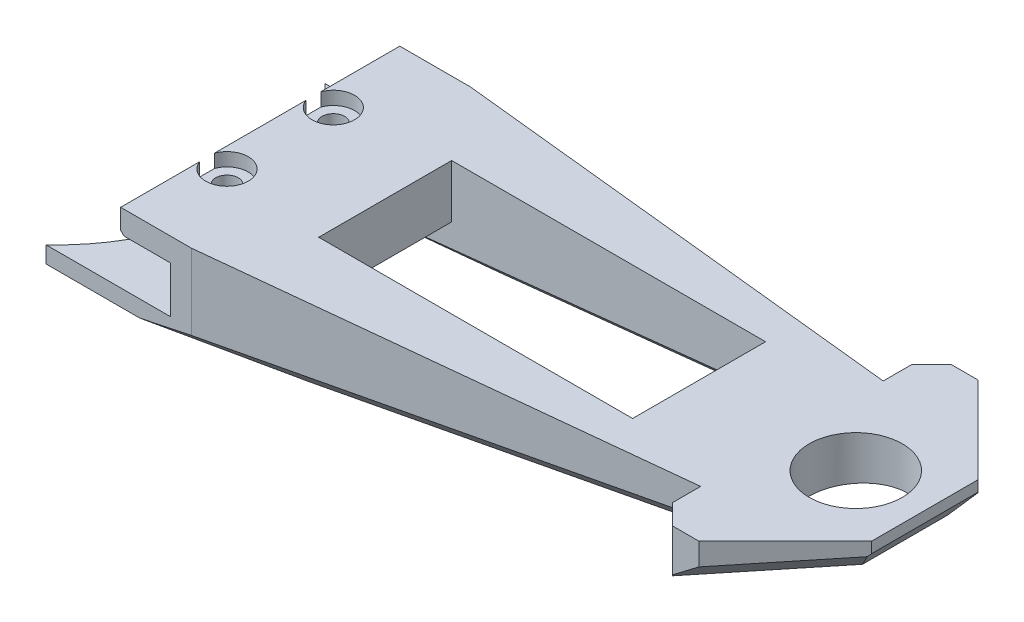
from build123d import *
from OCP.BRepFilletAPI import BRepFilletAPI_MakeChamfer

# Parameters (mm, degrees)
SKETCH_1_W          = 100
SKETCH_1_H          = 42
SKETCH_1_R          = 1.7
EXTRUDE_1_DEPTH     = 4
SKETCH_4_W          = 93
SKETCH_4_H          = 42
EXTRUDE_3_DEPTH     = 6
EXTRUDE_START       = 3
SKETCH_5_R          = 1.7
EXTRUDE_4_DEPTH     = 3
CHAMFER_1_SIZE      = 8
CHAMFER_1_SIZE2     = 76.114915634
CHAMFER_2_SIZE      = 1
SKETCH_13_W         = 47.230725809
SKETCH_13_H         = 10
SKETCH_13_R         = 7
CUT_EXTRUDE_4_DEPTH = 44
CHAMFER_6_SIZE      = 13
CHAMFER_7_SIZE      = 3
SKETCH_11_W         = 2.004930736
SKETCH_11_H         = 0.807415545
SKETCH_11_W_2       = 2.004930737
SKETCH_11_W_3       = 0.619925793
SKETCH_11_H_2       = 2.038195048
SKETCH_11_W_4       = 0.405219787
EXTRUDE_6_DEPTH     = 1
CHAMFER_8_SIZE      = 3
CHAMFER_8_SIZE2     = 3.249032056
CHAMFER_8_SIZE2_2   = 3.370811392
CHAMFER_9_SIZE      = 3
CHAMFER_9_SIZE2     = 3.033196678
CHAMFER_10_SIZE     = 5
CHAMFER_11_SIZE     = 3
CHAMFER_11_SIZE2    = 2.729629244
CHAMFER_12_SIZE     = 2
SKETCH_14_R         = 3.2
CUT_EXTRUDE_8_DEPTH = 2
CUT_EXTRUDE_9_DEPTH = 110


with BuildPart() as part:
    # 草图1 → 凸台-拉伸1 (new body)
    with BuildSketch(Plane(origin=(0, 0, 0), x_dir=(1, 0, 0), z_dir=(0, 1, 0))):
        with Locations((50, -21)):
            Rectangle(SKETCH_1_W, SKETCH_1_H)
        with Locations(Location((3, -29, 0), (0, 0, 270))):
            Circle(SKETCH_1_R, mode=Mode.SUBTRACT)
        with Locations(Location((3, -13, 0), (0, 0, 90))):
            Circle(SKETCH_1_R, mode=Mode.SUBTRACT)
    extrude(amount=EXTRUDE_1_DEPTH)

    # 草图4 → 凸台-拉伸3 (add)
    with BuildSketch(Plane.XZ):
        with Locations((53.5, 21)):
            Rectangle(SKETCH_4_W, SKETCH_4_H)
    extrude(amount=EXTRUDE_3_DEPTH)

    # 草图5 → 凸台-拉伸4 (add)
    with BuildSketch(Plane.XZ.offset(6).offset(EXTRUDE_START)):
        with BuildLine():
            Line((0, 42), (100, 42))
            Line((100, 42), (100, 0))
            Line((100, 0), (0, 0))
            Line((0, 0), (-11.232151132, 0))
            ThreePointArc((-11.232151132, 0), (-2, 21), (-11.232151132, 42))
            Line((-11.232151132, 42), (0, 42))
        make_face()
        with Locations(Location((3, 29, 0), (0, 0, 90))):
            Circle(SKETCH_5_R, mode=Mode.SUBTRACT)
        with Locations(Location((3, 13, 0), (0, 0, 270))):
            Circle(SKETCH_5_R, mode=Mode.SUBTRACT)
    extrude(amount=-EXTRUDE_4_DEPTH)

    # 倒角1
    chamfer_1_edges = [part.edges().sort_by_distance(p)[0] for p in [
        (100, -9, 21),
    ]]
    chamfer_1_side = [part.faces().sort_by_distance(p)[0] for p in [
        (100, -2.5, 21),
    ]]
    chamfer(chamfer_1_edges, length=CHAMFER_1_SIZE, length2=CHAMFER_1_SIZE2, reference=chamfer_1_side[0])

    # 倒角2
    chamfer_2_edges = [part.edges().sort_by_distance(p)[0] for p in [
        (0, 0, 21),
    ]]
    chamfer(chamfer_2_edges, length=CHAMFER_2_SIZE)

    # 草图13 → 切除-拉伸4 (cut)
    with BuildSketch(Plane(origin=(0, 4, 0), x_dir=(1, 0, 0), z_dir=(0, 1, 0))):
        Polygon((10.629734183, -42), (80, -42), (80, -34.736546255), align=None)
        with Locations((42.419369789, -26)):
            Rectangle(SKETCH_13_W, SKETCH_13_H)
        Polygon((80, -7.263453745), (80, 0), (10.629734183, 0), align=None)
        with Locations((42.419369789, -16)):
            Rectangle(SKETCH_13_W, SKETCH_13_H)
        with Locations(Location((89.611584168, -21, 0), (0, 0, 270))):
            Circle(SKETCH_13_R)
    extrude(amount=-CUT_EXTRUDE_4_DEPTH, mode=Mode.SUBTRACT)

    # 倒角6
    chamfer_6_edges = [part.edges().sort_by_distance(p)[0] for p in [
        (100, 1.5, 0),
        (100, 1.5, 42),
    ]]
    chamfer(chamfer_6_edges, length=CHAMFER_6_SIZE)

    # 倒角7
    chamfer_7_edges = [part.edges().sort_by_distance(p)[0] for p in [
        (80, 0.448957647, 42),
        (80, 0.448957647, 0),
    ]]
    chamfer(chamfer_7_edges, length=CHAMFER_7_SIZE)

    # 草图11 → 凸台-拉伸6 (add)
    # profile 1 of 3: a face of its own
    with BuildSketch(Plane(origin=(1.196575809, -11.384658341, 0), x_dir=(0.9945218953682733, 0.10452846326765426, 0), z_dir=(0.10452846326765428, -0.9945218953682734, 0))):
        Polygon((69.860880518, 16.187261812), (69.860880518, 17.411993258), (70.105826807, 17.411993258), (70.105826807, 18.22545686), (69.65675861, 18.671501028), (70.553382989, 19.852384064), (71.121900302, 19.444140249), (77.544936327, 19.444140249), (77.544936327, 18.219408803), (76.810097459, 18.219408803), (76.810097459, 17.411993258), (77.62658509, 17.411993258), (77.62658509, 16.187261812), align=None)
        with Locations((74.909495698, 17.815701031)):
            Rectangle(SKETCH_11_W, SKETCH_11_H, mode=Mode.SUBTRACT)
        with Locations((72.006428569, 17.815701031)):
            Rectangle(SKETCH_11_W_2, SKETCH_11_H, mode=Mode.SUBTRACT)
    # profile 2 of 3: a face of its own
    with BuildSketch(Plane(origin=(1.196575809, -11.384658341, 0), x_dir=(0.9945218953682733, 0.10452846326765426, 0), z_dir=(0.10452846326765428, -0.9945218953682734, 0))):
        with BuildLine():
            Line((73.743732804, 20.141178762), (73.743732804, 21.489895366))
            Line((73.743732804, 21.489895366), (73.988679093, 21.489895366))
            Line((73.988679093, 21.489895366), (73.988679093, 23.570426809))
            Line((73.988679093, 23.570426809), (73.580435278, 23.937846243))
            Line((73.580435278, 23.937846243), (74.396922908, 25.244226451))
            Line((74.396922908, 25.244226451), (74.8883275, 24.876807018))
            Line((74.8883275, 24.876807018), (77.873043393, 24.876807018))
            add(Edge.make_bspline(
                [(77.873043393, 24.876807018), (77.909195425, 24.884114021), (77.979030125, 24.898228922), (78.083535505, 24.898260892), (78.18247526, 24.888096269), (78.274375586, 24.857634965), (78.361174864, 24.815510666), (78.440062892, 24.754438601), (78.514651653, 24.680459701), (78.581581254, 24.589308152), (78.641153636, 24.483219793), (78.695783555, 24.362834367), (78.74420221, 24.227285764), (78.78536843, 24.075844921), (78.823948154, 23.909673827), (78.853080426, 23.727704353), (78.87757312, 23.53102708), (78.888168983, 23.394584904), (78.893652931, 23.323968506)],
                knots=[0, 0, 0, 0, 0.827263588, 1.598020928, 2.340253185, 3.053540043, 3.76312571, 4.499799397, 5.285166813, 6.119311175, 7.033042428, 8.016965305, 9.088859635, 10.265792637, 11.544263093, 12.923035739, 14.407500252, 16, 16, 16, 16], degree=3))
            add(Edge.make_bspline(
                [(78.893652931, 23.323968506), (78.845246059, 23.328323663), (78.753264032, 23.336599269), (78.620846423, 23.311971446), (78.505741453, 23.257011785), (78.407474701, 23.17222843), (78.32882796, 23.056565697), (78.267259898, 22.912798583), (78.222626533, 22.740439523), (78.20762963, 22.615095523), (78.199638445, 22.548305257)],
                knots=[0, 0, 0, 0, 0.974397038, 1.851534954, 2.672531398, 3.514004096, 4.431205496, 5.461919598, 6.647569389, 8, 8, 8, 8], degree=3))
            Line((78.199638445, 22.548305257), (77.668921485, 22.466656494))
            add(Edge.make_bspline(
                [(77.668921485, 22.466656494), (77.676599849, 22.514514334), (77.691289688, 22.606073427), (77.710604215, 22.73849245), (77.721281907, 22.861229398), (77.732590351, 22.973497898), (77.732180701, 23.075975967), (77.733151762, 23.168024765), (77.722536119, 23.249609583), (77.711807698, 23.321856538), (77.693885438, 23.383253279), (77.671409021, 23.435462621), (77.641955792, 23.475795943), (77.610544471, 23.510743362), (77.569530677, 23.529227283), (77.525069221, 23.54104806), (77.475191645, 23.540431553), (77.441487802, 23.532310259), (77.423975196, 23.528090414)],
                knots=[0, 0, 0, 0, 1.834201696, 3.509097869, 5.061374665, 6.496278519, 7.774185948, 8.937680646, 9.973858727, 10.883093303, 11.697811954, 12.389123654, 13.018759541, 13.585142942, 14.139519144, 14.689944872, 15.319291869, 16, 16, 16, 16], degree=3))
            Line((77.423975196, 23.528090414), (77.26067767, 23.528090414))
            Line((77.26067767, 23.528090414), (77.26067767, 21.489895366))
            Line((77.26067767, 21.489895366), (78.812004168, 21.489895366))
            Line((78.812004168, 21.489895366), (78.812004168, 20.141178762))
            Line((78.812004168, 20.141178762), (73.743732804, 20.141178762))
        make_face()
        with Locations((76.215875907, 22.50899289)):
            Rectangle(SKETCH_11_W_3, SKETCH_11_H_2, mode=Mode.SUBTRACT)
        with Locations((74.96846425, 22.50899289)):
            Rectangle(SKETCH_11_W_4, SKETCH_11_H_2, mode=Mode.SUBTRACT)
    # profile 3 of 3: a face of its own
    with BuildSketch(Plane(origin=(1.196575809, -11.384658341, 0), x_dir=(0.9945218953682733, 0.10452846326765426, 0), z_dir=(0.10452846326765428, -0.9945218953682734, 0))):
        Polygon((70.021154016, 19.766199258), (70.021154016, 21.766593952), (69.204666385, 21.766593952), (69.204666385, 23.154622924), (70.021154016, 23.154622924), (70.021154016, 23.930286172), (69.572085819, 24.297705606), (70.388573449, 25.399963907), (70.798329279, 25.073368855), (70.798329279, 23.154622924), (71.30031797, 23.154622924), (71.30031797, 23.685339883), (70.851249773, 24.052759317), (71.626913022, 25.114193236), (72.035156837, 24.787598184), (72.035156837, 23.154622924), (72.633914432, 23.154622924), (72.633914432, 24.338529987), (72.184846236, 24.665125039), (73.001333866, 25.726558959), (73.411089695, 25.399963907), (73.411089695, 19.725374877), (72.633914432, 19.562077351), (72.633914432, 21.766593952), (72.035156837, 21.766593952), (72.035156837, 20.256091836), (71.30031797, 20.051969929), (71.30031797, 21.766593952), (70.798329279, 21.766593952), (70.798329279, 19.970321166), align=None)
    extrude(amount=EXTRUDE_6_DEPTH)

    # 倒角8: one chamfer whose edges measure the first distance from different faces: ONE call of the kernel's chamfer builder (chamfer() names one face for all edges)
    chamfer_8_edges_1 = [part.edges().sort_by_distance(p)[0] for p in [
        (93.5, -1.683177529, 6.5),
    ]]
    chamfer_8_side_1 = [part.faces().sort_by_distance(p)[0] for p in [
        (93.239543948, 1.144723718, 6.239543948),
    ]]
    chamfer_8_edges_2 = [part.edges().sort_by_distance(p)[0] for p in [
        (93.5, -1.683177529, 35.5),
    ]]
    chamfer_8_side_2 = [part.faces().sort_by_distance(p)[0] for p in [
        (93.239543948, 1.144723718, 35.760456052),
    ]]
    chamfer_8_edges_3 = [part.edges().sort_by_distance(p)[0] for p in [
        (100, -1, 21),
    ]]
    chamfer_8_side_3 = [part.faces().sort_by_distance(p)[0] for p in [
        (85, -2.576563529, 41.126989093),
    ]]
    chamfer_8 = BRepFilletAPI_MakeChamfer(part.part.solid().wrapped)
    for e in chamfer_8_edges_1:
        chamfer_8.Add(CHAMFER_8_SIZE, CHAMFER_8_SIZE2, e.wrapped, chamfer_8_side_1[0].wrapped)  # the first distance lies on this face
    for e in chamfer_8_edges_2:
        chamfer_8.Add(CHAMFER_8_SIZE, CHAMFER_8_SIZE2, e.wrapped, chamfer_8_side_2[0].wrapped)  # the first distance lies on this face
    for e in chamfer_8_edges_3:
        chamfer_8.Add(CHAMFER_8_SIZE, CHAMFER_8_SIZE2_2, e.wrapped, chamfer_8_side_3[0].wrapped)  # the first distance lies on this face
    add(Compound.cast(chamfer_8.Shape()), mode=Mode.REPLACE)

    # 倒角9: one chamfer whose edges measure the first distance from different faces: ONE call of the kernel's chamfer builder (chamfer() names one face for all edges)
    chamfer_9_edges_1 = [part.edges().sort_by_distance(p)[0] for p in [
        (51.942542183, -6.051042353, 37.674318579),
    ]]
    chamfer_9_side_1 = [part.faces().sort_by_distance(p)[0] for p in [
        (41.723549869, -1.481040701, 38.744304071),
    ]]
    chamfer_9_edges_2 = [part.edges().sort_by_distance(p)[0] for p in [
        (51.942542183, -6.051042353, 4.325681421),
    ]]
    chamfer_9_side_2 = [part.faces().sort_by_distance(p)[0] for p in [
        (81.946304921, -2.897519815, 39.756028252),
    ]]
    chamfer_9 = BRepFilletAPI_MakeChamfer(part.part.solid().wrapped)
    for e in chamfer_9_edges_1:
        chamfer_9.Add(CHAMFER_9_SIZE, CHAMFER_9_SIZE2, e.wrapped, chamfer_9_side_1[0].wrapped)  # the first distance lies on this face
    for e in chamfer_9_edges_2:
        chamfer_9.Add(CHAMFER_9_SIZE, CHAMFER_9_SIZE2, e.wrapped, chamfer_9_side_2[0].wrapped)  # the first distance lies on this face
    add(Compound.cast(chamfer_9.Shape()), mode=Mode.REPLACE)

    # 倒角10
    chamfer_10_edges = [part.edges().sort_by_distance(p)[0] for p in [
        (18.804006885, -9, 21),
    ]]
    chamfer(chamfer_10_edges, length=CHAMFER_10_SIZE)

    # 倒角11
    chamfer_11_edges = [part.edges().sort_by_distance(p)[0] for p in [
        (66.034732694, -4.569893446, 21),
    ]]
    chamfer_11_side = [part.faces().sort_by_distance(p)[0] for p in [
        (24.724422242, -8.911782034, 34.281246688),
    ]]
    chamfer(chamfer_11_edges, length=CHAMFER_11_SIZE, length2=CHAMFER_11_SIZE2, reference=chamfer_11_side[0])

    # 倒角12
    # the kernel refuses this chamfer: 2 mm, written as the material it takes off along each edge
    with BuildSketch(Plane(origin=(-1.690866029, -11.688140707, 31), x_dir=(-0.10452846326765075, 0.9945218953682736, 0), z_dir=(0.9945218953682737, 0.10452846326765075, 0))) as chamfer_12_piece_1_section:
        Polygon((CHAMFER_12_SIZE, 0), (0, CHAMFER_12_SIZE), (0, 0), align=None)
    chamfer_12_piece_1 = extrude(amount=76.24201623, mode=Mode.PRIVATE)
    chamfer_12_piece_1 = split(chamfer_12_piece_1, bisect_by=Plane(origin=(4.712500075, -18.091506811, 31), z_dir=(0.7071067811865476, -0.7071067811865476, 0)), keep=Keep.TOP, mode=Mode.PRIVATE)
    chamfer_12_piece_1 = split(chamfer_12_piece_1, bisect_by=Plane(origin=(29.94779985, 27.382357822, 31), z_dir=(-0.6293203910498405, -0.7771459614569685, 0)), keep=Keep.TOP, mode=Mode.PRIVATE)
    add(chamfer_12_piece_1, mode=Mode.SUBTRACT)
    with BuildSketch(Plane(origin=(-1.690866029, -11.688140707, 11), x_dir=(-0.10452846326765075, 0.9945218953682736, 0), z_dir=(0.9945218953682737, 0.10452846326765075, 0))) as chamfer_12_piece_2_section:
        Polygon((CHAMFER_12_SIZE, 0), (0, -CHAMFER_12_SIZE), (0, 0), align=None)
    chamfer_12_piece_2 = extrude(amount=76.24201623, mode=Mode.PRIVATE)
    chamfer_12_piece_2 = split(chamfer_12_piece_2, bisect_by=Plane(origin=(4.712500075, -18.091506811, 11), z_dir=(0.7071067811865476, -0.7071067811865476, 0)), keep=Keep.TOP, mode=Mode.PRIVATE)
    chamfer_12_piece_2 = split(chamfer_12_piece_2, bisect_by=Plane(origin=(29.94779985, 27.382357822, 11), z_dir=(-0.6293203910498405, -0.7771459614569685, 0)), keep=Keep.TOP, mode=Mode.PRIVATE)
    add(chamfer_12_piece_2, mode=Mode.SUBTRACT)

    # 草图14 → 切除-拉伸8 (cut)
    with BuildSketch(Plane(origin=(0, 4, 0), x_dir=(1, 0, 0), z_dir=(0, 1, 0))):
        with Locations((3, -13)):
            Circle(SKETCH_14_R)
        with Locations((3, -29)):
            Circle(SKETCH_14_R)
    extrude(amount=-CUT_EXTRUDE_8_DEPTH, mode=Mode.SUBTRACT)

    # 草图15 → 切除-拉伸9 (cut)
    with BuildSketch(Plane(origin=(0, 0, 0), x_dir=(-1, 0, 0), z_dir=(0, 0, -1))):
        Polygon((-7, 0.5), (16.731538073, 0.5), (16.731538073, -6.5), (-7, -6.5), (-7.5, -6.5), (-7.5, 0.5), align=None)
    extrude(amount=-CUT_EXTRUDE_9_DEPTH, mode=Mode.SUBTRACT)


solid = part.part
